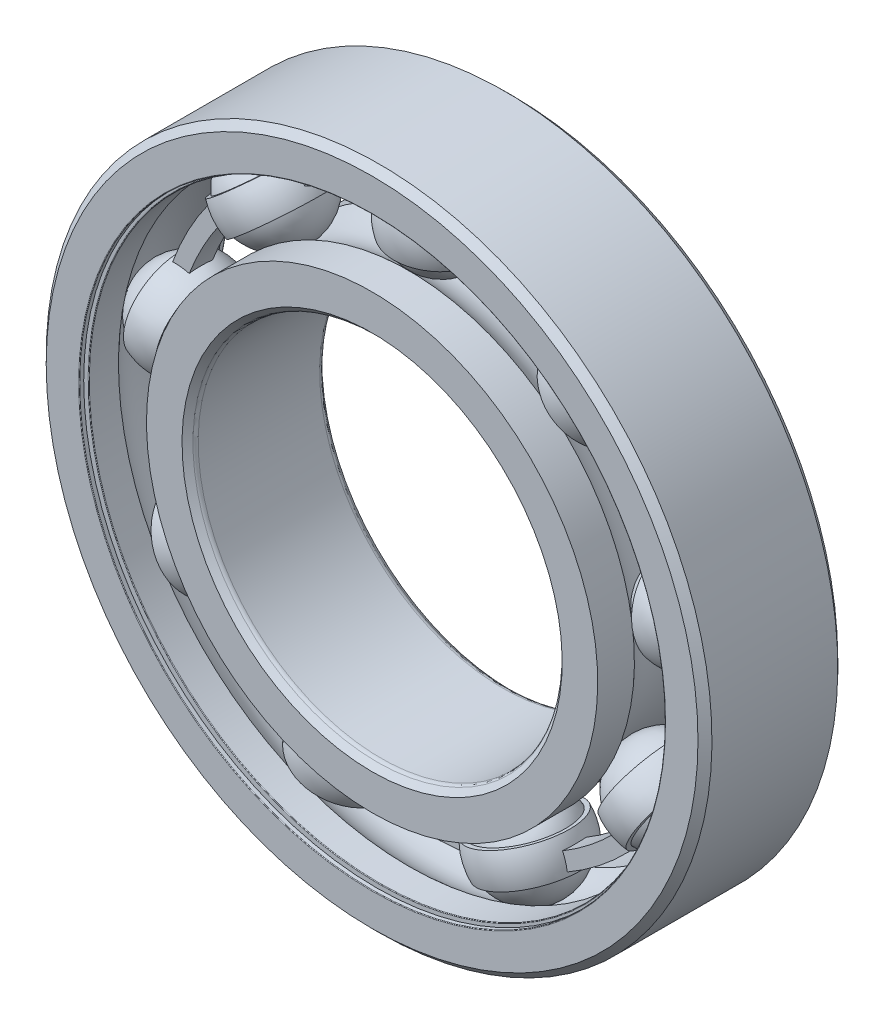
from build123d import *

# Parameters (mm, degrees)
BOSS_EXTRUDE1_DEPTH = 1.75
CIRPATTERN1_COUNT   = 9
CIRPATTERN2_COUNT   = 9
FILLET1_R           = 0.0945
FILLET2_R           = 0.7875


with BuildPart() as part:
    # Sketch3 → Revolve1 (revolve)
    with BuildSketch(Plane(origin=(0, 0, 0), x_dir=(0, 0, -1), z_dir=(1, 0, 0))):
        with BuildLine():
            Line((9.45, 50), (10.5, 48.95))
            Line((10.5, 48.95), (10.5, 43.611538462))
            Line((10.5, 43.611538462), (4.9875, 43.611538462))
            ThreePointArc((4.9875, 43.611538462), (0, 45.714891418), (-4.9875, 43.611538462))
            Line((-4.9875, 43.611538462), (-10.5, 43.611538462))
            Line((-10.5, 43.611538462), (-10.5, 48.95))
            Line((-10.5, 48.95), (-9.45, 50))
            Line((-9.45, 50), (9.45, 50))
        make_face()
    revolve(axis=Axis((0, 0, 10.5), (0, 0, -1)))

    # Sketch8 → Cut-Revolve1 (revolve, cut)
    with BuildSketch(Plane(origin=(0, 0, 0), x_dir=(0, 0, -1), z_dir=(1, 0, 0))):
        Polygon((-9.828, 43.611538462), (-9.45, 43.611538462), (-9.45, 45.741025641), (-9.828, 45.741025641), (-9.828, 43.989538462), (-10.5, 43.989538462), (-10.5, 43.611538462), align=None)
        Polygon((9.45, 43.611538462), (9.828, 43.611538462), (10.5, 43.611538462), (10.5, 43.989538462), (9.828, 43.989538462), (9.828, 45.741025641), (9.45, 45.741025641), align=None)
    revolve(axis=Axis((0, 0, 10.5), (0, 0, -1)), mode=Mode.SUBTRACT)

    # Fillet1
    fillet1_edges = [part.edges().sort_by_distance(p)[0] for p in [
        (0, -43.611538462, -9.45),
        (0, -43.989538462, -10.5),
        (0, -43.611538462, 9.45),
        (0, -43.989538462, 10.5),
    ]]
    fillet(fillet1_edges, radius=FILLET1_R)


with BuildPart() as body_2:
    # Sketch4 → Revolve2 (revolve)
    with BuildSketch(Plane(origin=(0, 0, 0), x_dir=(0, 0, -1), z_dir=(1, 0, 0))):
        with BuildLine():
            Line((-9.45, 27.5), (-10.5, 28.55))
            Line((-10.5, 28.55), (-10.5, 33.888461538))
            Line((-10.5, 33.888461538), (-4.9875, 33.888461538))
            ThreePointArc((-4.9875, 33.888461538), (0, 31.785108582), (4.9875, 33.888461538))
            Line((4.9875, 33.888461538), (10.5, 33.888461538))
            Line((10.5, 33.888461538), (10.5, 28.55))
            Line((10.5, 28.55), (9.45, 27.5))
            Line((9.45, 27.5), (-9.45, 27.5))
        make_face()
    revolve(axis=Axis((0, 0, 10.5), (0, 0, -1)))

    # Fillet2
    fillet2_edges = [body_2.edges().sort_by_distance(p)[0] for p in [
        (0, -27.5, -9.45),
        (0, -27.5, 9.45),
    ]]
    fillet(fillet2_edges, radius=FILLET2_R)


with BuildPart() as body_3:
    # Sketch5 → Revolve3 (revolve)
    with BuildSketch(Plane(origin=(0, 0, 0), x_dir=(0, 0, -1), z_dir=(1, 0, 0))):
        with BuildLine():
            Line((-6.964891418, 38.75), (6.964891418, 38.75))
            ThreePointArc((6.964891418, 38.75), (0, 45.714891418), (-6.964891418, 38.75))
        make_face()
    revolve(axis=Axis((0, 38.75, 6.964891418), (0, 0, -1)))


with BuildPart() as body_4:
    # Sketch6 → Revolve4 (revolve)
    with BuildSketch(Plane(origin=(0, 0, 0), x_dir=(0, 0, -1), z_dir=(1, 0, 0))):
        with BuildLine():
            Line((-6.526949778, 41.180769231), (-7.189124815, 41.180769231))
            ThreePointArc((-7.189124815, 41.180769231), (-7.520212334, 38.75), (-7.189124815, 36.319230769))
            Line((-7.189124815, 36.319230769), (-6.526949778, 36.319230769))
            ThreePointArc((-6.526949778, 36.319230769), (-6.964891418, 38.75), (-6.526949778, 41.180769231))
        make_face()
    revolve4 = revolve(axis=Axis((0, 50, 0), (0, -1, 0)))

    # Sketch7 → Boss-Extrude1 (add, symmetric)
    with BuildSketch(Plane.XY):
        with BuildLine():
            Line((24.908019875, 29.684222171), (26.470488219, 31.546299433))
            ThreePointArc((26.470488219, 31.546299433), (14.084652595, 38.697264964), (0, 41.180769231))
            Line((0, 41.180769231), (0, 38.75))
            ThreePointArc((0, 38.75), (13.253280554, 36.413089055), (24.908019875, 29.684222171))
        make_face()
    boss_extrude1 = extrude(amount=BOSS_EXTRUDE1_DEPTH, both=True)

    # CirPattern2: Revolve4, Boss-Extrude1 ×9 about axis
    cirpattern2_axis = Axis((0, 0, 10.5), (0, 0, -1))
    add([revolve4.rotate(cirpattern2_axis, i * 360 / CIRPATTERN2_COUNT) for i in range(1, CIRPATTERN2_COUNT)])
    add([boss_extrude1.rotate(cirpattern2_axis, i * 360 / CIRPATTERN2_COUNT) for i in range(1, CIRPATTERN2_COUNT)])


with BuildPart() as cirpattern1_1:
    # CirPattern1: pattern copy
    add(body_3.part.rotate(Axis((0, 0, 10.5), (0, 0, -1)), 1 * 360 / CIRPATTERN1_COUNT))


with BuildPart() as cirpattern1_2:
    # CirPattern1: pattern copy
    add(body_3.part.rotate(Axis((0, 0, 10.5), (0, 0, -1)), 2 * 360 / CIRPATTERN1_COUNT))


with BuildPart() as cirpattern1_3:
    # CirPattern1: pattern copy
    add(body_3.part.rotate(Axis((0, 0, 10.5), (0, 0, -1)), 3 * 360 / CIRPATTERN1_COUNT))


with BuildPart() as cirpattern1_4:
    # CirPattern1: pattern copy
    add(body_3.part.rotate(Axis((0, 0, 10.5), (0, 0, -1)), 4 * 360 / CIRPATTERN1_COUNT))


with BuildPart() as cirpattern1_5:
    # CirPattern1: pattern copy
    add(body_3.part.rotate(Axis((0, 0, 10.5), (0, 0, -1)), 5 * 360 / CIRPATTERN1_COUNT))


with BuildPart() as cirpattern1_6:
    # CirPattern1: pattern copy
    add(body_3.part.rotate(Axis((0, 0, 10.5), (0, 0, -1)), 6 * 360 / CIRPATTERN1_COUNT))


with BuildPart() as cirpattern1_7:
    # CirPattern1: pattern copy
    add(body_3.part.rotate(Axis((0, 0, 10.5), (0, 0, -1)), 7 * 360 / CIRPATTERN1_COUNT))


with BuildPart() as cirpattern1_8:
    # CirPattern1: pattern copy
    add(body_3.part.rotate(Axis((0, 0, 10.5), (0, 0, -1)), 8 * 360 / CIRPATTERN1_COUNT))


solid = Compound([part.part, body_2.part, body_3.part, body_4.part, cirpattern1_1.part, cirpattern1_2.part, cirpattern1_3.part, cirpattern1_4.part, cirpattern1_5.part, cirpattern1_6.part, cirpattern1_7.part, cirpattern1_8.part])
